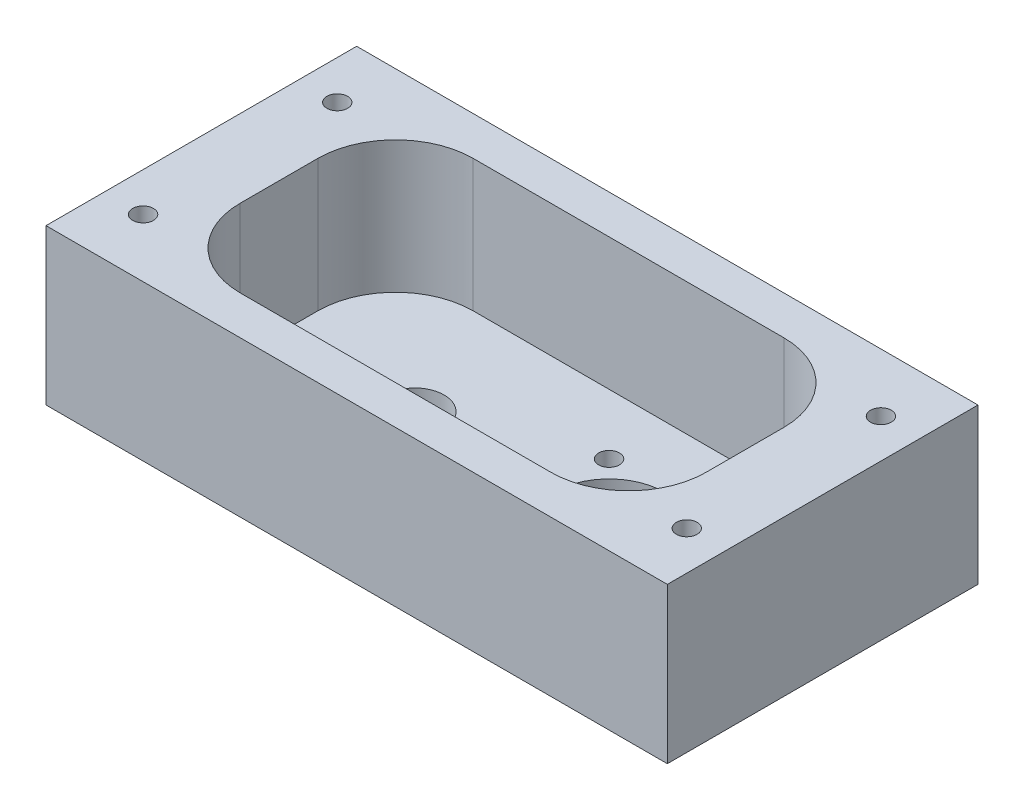
from build123d import *

# Parameters (mm, degrees)
SKETCH1_W            = 101.6
SKETCH1_H            = 50.8
BOSS_EXTRUDE1_DEPTH  = 25.4
SKETCH2_R            = 4.7625
SKETCH2_R_2          = 9
CUT_EXTRUDE1_DEPTH   = 63.217039467
CUT_EXTRUDE2_DEPTH   = 21.59
M3_CLEARANCE_HOLE1_D = 3.4


with BuildPart() as part:
    # Sketch1 → Boss-Extrude1 (new body)
    with BuildSketch(Plane(origin=(0, 0, 0), x_dir=(1, 0, 0), z_dir=(0, 1, 0))):
        Rectangle(SKETCH1_W, SKETCH1_H)
    extrude(amount=BOSS_EXTRUDE1_DEPTH)

    # Sketch2 → Cut-Extrude1 (cut, through all)
    with BuildSketch(Plane.XZ):
        with Locations((-15.875, 0)):
            Circle(SKETCH2_R)
        with Locations((15.875, 0)):
            Circle(SKETCH2_R_2)
    extrude(amount=-CUT_EXTRUDE1_DEPTH, mode=Mode.SUBTRACT)

    # Sketch3 → Cut-Extrude2 (cut)
    with BuildSketch(Plane(origin=(0, 25.4, 0), x_dir=(1, 0, 0), z_dir=(0, 1, 0))):
        with BuildLine():
            Line((-25.4, -19.05), (25.4, -19.05))
            ThreePointArc((25.4, -19.05), (34.380256121, -15.330256121), (38.1, -6.35))
            Line((38.1, -6.35), (38.1, 6.35))
            ThreePointArc((38.1, 6.35), (34.380256121, 15.330256121), (25.4, 19.05))
            Line((25.4, 19.05), (-25.4, 19.05))
            ThreePointArc((-25.4, 19.05), (-34.380256121, 15.330256121), (-38.1, 6.35))
            Line((-38.1, 6.35), (-38.1, -6.35))
            ThreePointArc((-38.1, -6.35), (-34.380256121, -15.330256121), (-25.4, -19.05))
        make_face()
    extrude(amount=-CUT_EXTRUDE2_DEPTH, mode=Mode.SUBTRACT)

    # M3 Clearance Hole1 (through all)
    with Locations(Plane(origin=(-44.45, 0, 15.875), x_dir=(0, 0, -1), z_dir=(0, -1, 0))):
        with Locations((0, 0), (31.75, 0), (6.682611845, 51.132611845), (25.067388155, 51.132611845), (6.682611845, 69.517388155), (25.067388155, 69.517388155), (0, 88.9), (31.75, 88.9)):
            Hole(M3_CLEARANCE_HOLE1_D / 2)


solid = part.part
